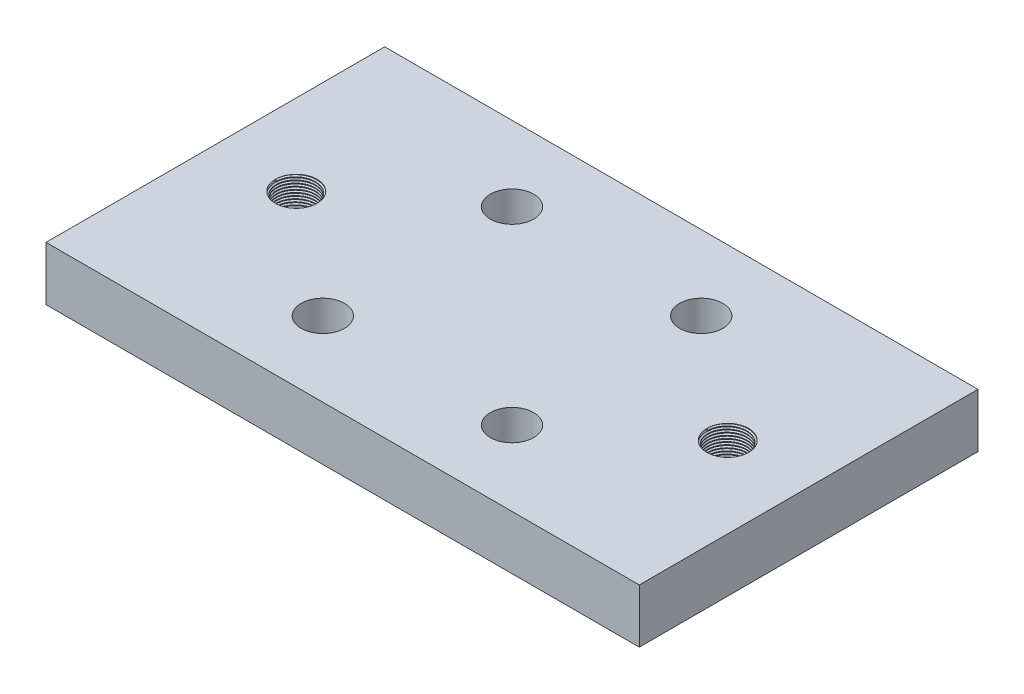
from build123d import *
from build123d.topology import SkipClean

# Parameters (mm, degrees)
SKETCH1_W                                          = 69.85
SKETCH1_H                                          = 39.878
BOSS_EXTRUDE1_DEPTH                                = 6.35
CSK_FOR_10_FLAT_HEAD_MACHINE_SCREW_100_D           = 5.1054
CSK_FOR_10_FLAT_HEAD_MACHINE_SCREW_100_CSINK_D     = 9.779
CSK_FOR_10_FLAT_HEAD_MACHINE_SCREW_100_CSINK_ANGLE = 100
F_10_0_1935_DIAMETER_HOLE1_D                       = 4.9149
THREAD1_PITCH                                      = 0.3175
THREAD2_PITCH                                      = 0.3175


with BuildPart() as part:
    # Sketch1 → Boss-Extrude1 (new body)
    with BuildSketch(Plane(origin=(0, 0, 0), x_dir=(1, 0, 0), z_dir=(0, 1, 0))):
        Rectangle(SKETCH1_W, SKETCH1_H)
    extrude(amount=BOSS_EXTRUDE1_DEPTH)

    # CSK for #10 Flat Head Machine Screw (100)1 (through all)
    with Locations(Plane(origin=(0, 0, 0), x_dir=(-1, 0, 0), z_dir=(0, -1, 0))):
        with Locations((-11.136931804, 11.136931804), (11.136931804, 11.136931804), (11.136931804, -11.136931804), (-11.136931804, -11.136931804)):
            CounterSinkHole(CSK_FOR_10_FLAT_HEAD_MACHINE_SCREW_100_D / 2, CSK_FOR_10_FLAT_HEAD_MACHINE_SCREW_100_CSINK_D / 2, counter_sink_angle=CSK_FOR_10_FLAT_HEAD_MACHINE_SCREW_100_CSINK_ANGLE)

    # #10 (0.1935) Diameter Hole1 (through all)
    with Locations(Plane(origin=(0, 0, 0), x_dir=(-1, 0, 0), z_dir=(0, -1, 0))):
        with Locations((-25.4, 0)):
            f_10_0_1935_diameter_hole1 = Hole(F_10_0_1935_DIAMETER_HOLE1_D / 2)

    # Mirror1: #10 (0.1935) Diameter Hole1 across plane
    add(f_10_0_1935_diameter_hole1.mirror(Plane(origin=(0, 0, 0), x_dir=(0, 0, 1), z_dir=(1, 0, 0))), mode=Mode.SUBTRACT)

    # Thread1: the profile of Thread Profile1 profile screwed along a right-hand helix of 20 turns, 6 arcs to a turn; built about Z, then put on its axis
    with SkipClean():  # the faces are left unmerged after this step: merging them gives an invalid solid
        thread1_z = Axis((0, 0, 0), (0, 0, 1))
        thread1_corners = [(2.45775, 0, -0.000173205), (2.45775, 0, 0.277985704), (2.285598085, 0, 0.17859375), (2.285598085, 0, 0.09921875)]
        with BuildLine(mode=Mode.PRIVATE) as thread1_profile:
            Line(thread1_corners[0], thread1_corners[1])
            Line(thread1_corners[1], thread1_corners[2])
            Line(thread1_corners[2], thread1_corners[3])
            Line(thread1_corners[3], thread1_corners[0])
        thread1_cap = Face(thread1_profile.wire())
        thread1_turn_angles = [0, 30, 60, 90, 120, 150, 180, 210, 240, 270, 300, 330, 360]
        thread1_turn_weights = [1, 0.8660254037844387, 1, 0.8660254037844387, 1, 0.8660254037844387, 1, 0.8660254037844387, 1, 0.8660254037844387, 1, 0.8660254037844387, 1]
        thread1_turn_rails = [Edge.make_bspline([Vector(p[0], p[1], 0).rotate(thread1_z, thread1_turn_angles[k]) / thread1_turn_weights[k] + Vector(0, 0, p[2] + THREAD1_PITCH * thread1_turn_angles[k] / 360) for k in range(13)], [0, 0, 0, 1, 1, 2, 2, 3, 3, 4, 4, 5, 5, 6, 6, 6], 2, thread1_turn_weights) for p in thread1_corners]
        thread1_turn_sides = [Face.make_surface_from_curves(thread1_turn_rails[p[0]], thread1_turn_rails[p[1]]) for p in [(0, 1), (1, 2), (2, 3), (3, 0)]]
        thread1 = Plane(origin=(25.4, 6.35, 0), x_dir=(-1, 0, 0), z_dir=(0, -1, 0)) * Solid(Shell([*[p.moved(Location((0, 0, THREAD1_PITCH * i))) for i in range(20) for p in thread1_turn_sides], thread1_cap, thread1_cap.rotate(thread1_z, 7200).moved(Location((0, 0, THREAD1_PITCH * 7200 / 360)))]))
        add(thread1)

    # Thread2: the profile of Thread Profile2 profile screwed along a right-hand helix of 20 turns, 6 arcs to a turn; built about Z, then put on its axis
    with SkipClean():  # the faces are left unmerged after this step: merging them gives an invalid solid
        thread2_z = Axis((0, 0, 0), (0, 0, 1))
        thread2_corners = [(2.45775, 0, -0.000173205), (2.45775, 0, 0.277985704), (2.285598085, 0, 0.17859375), (2.285598085, 0, 0.09921875)]
        with BuildLine(mode=Mode.PRIVATE) as thread2_profile:
            Line(thread2_corners[0], thread2_corners[1])
            Line(thread2_corners[1], thread2_corners[2])
            Line(thread2_corners[2], thread2_corners[3])
            Line(thread2_corners[3], thread2_corners[0])
        thread2_cap = Face(thread2_profile.wire())
        thread2_turn_angles = [0, 30, 60, 90, 120, 150, 180, 210, 240, 270, 300, 330, 360]
        thread2_turn_weights = [1, 0.8660254037844387, 1, 0.8660254037844387, 1, 0.8660254037844387, 1, 0.8660254037844387, 1, 0.8660254037844387, 1, 0.8660254037844387, 1]
        thread2_turn_rails = [Edge.make_bspline([Vector(p[0], p[1], 0).rotate(thread2_z, thread2_turn_angles[k]) / thread2_turn_weights[k] + Vector(0, 0, p[2] + THREAD2_PITCH * thread2_turn_angles[k] / 360) for k in range(13)], [0, 0, 0, 1, 1, 2, 2, 3, 3, 4, 4, 5, 5, 6, 6, 6], 2, thread2_turn_weights) for p in thread2_corners]
        thread2_turn_sides = [Face.make_surface_from_curves(thread2_turn_rails[p[0]], thread2_turn_rails[p[1]]) for p in [(0, 1), (1, 2), (2, 3), (3, 0)]]
        thread2 = Plane(origin=(-25.4, 6.35, 0), x_dir=(-1, 0, 0), z_dir=(0, -1, 0)) * Solid(Shell([*[p.moved(Location((0, 0, THREAD2_PITCH * i))) for i in range(20) for p in thread2_turn_sides], thread2_cap, thread2_cap.rotate(thread2_z, 7200).moved(Location((0, 0, THREAD2_PITCH * 7200 / 360)))]))
        add(thread2)


solid = part.part
